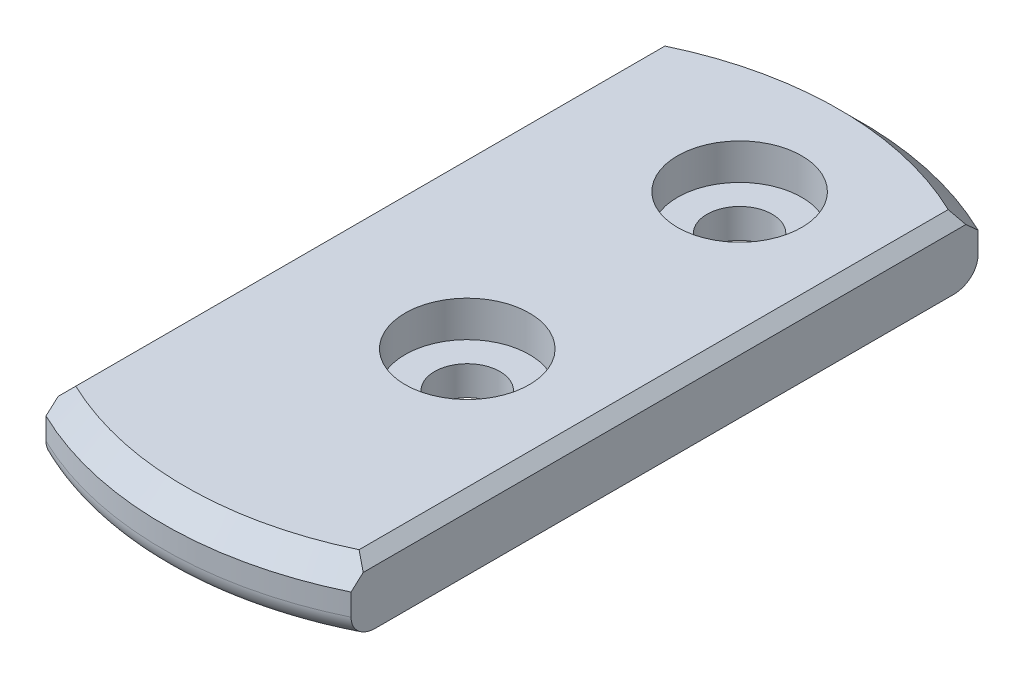
from build123d import *

# Parameters (mm, degrees)
SKETCH2_R           = 16
BOSS_EXTRUDE1_DEPTH = 3
SKETCH1_W           = 9
SKETCH1_H           = 32
CUT_EXTRUDE1_DEPTH  = 23.825424421
SKETCH3_R           = 1.5
CUT_EXTRUDE2_DEPTH  = 18.720045147
SKETCH4_R           = 2.85
CUT_EXTRUDE3_DEPTH  = 1.65
CHAMFER1_SIZE       = 0.5
FILLET1_R           = 1
CHAMFER2_SIZE       = 1


with BuildPart() as part:
    # Sketch2 → Boss-Extrude1 (new body)
    with BuildSketch(Plane(origin=(0, 0, 0), x_dir=(1, 0, 0), z_dir=(0, 1, 0))):
        Circle(SKETCH2_R)
    extrude(amount=BOSS_EXTRUDE1_DEPTH)

    # Sketch1 → Cut-Extrude1 (cut, through all)
    with BuildSketch(Plane(origin=(0, 0, 0), x_dir=(1, 0, 0), z_dir=(0, 1, 0))):
        with Locations((-11.5, 0)):
            Rectangle(SKETCH1_W, SKETCH1_H)
        with Locations((11.5, 0)):
            Rectangle(SKETCH1_W, SKETCH1_H)
    extrude(amount=CUT_EXTRUDE1_DEPTH, mode=Mode.SUBTRACT)

    # Sketch3 → Cut-Extrude2 (cut, through all)
    with BuildSketch(Plane(origin=(0, 3, 0), x_dir=(1, 0, 0), z_dir=(0, 1, 0))):
        with Locations((1, 9.4472)):
            Circle(SKETCH3_R)
        with Locations((1, -3.0528)):
            Circle(SKETCH3_R)
    extrude(amount=-CUT_EXTRUDE2_DEPTH, mode=Mode.SUBTRACT)

    # Sketch4 → Cut-Extrude3 (cut)
    with BuildSketch(Plane(origin=(0, 3, 0), x_dir=(1, 0, 0), z_dir=(0, 1, 0))):
        with Locations((1, 9.4472)):
            Circle(SKETCH4_R)
        with Locations((1, -3.0528)):
            Circle(SKETCH4_R)
    extrude(amount=-CUT_EXTRUDE3_DEPTH, mode=Mode.SUBTRACT)

    # Chamfer1
    chamfer1_edges = [part.edges().sort_by_distance(p)[0] for p in [
        (-7, 3, 0),
        (7, 3, 0),
    ]]
    chamfer(chamfer1_edges, length=CHAMFER1_SIZE)

    # Fillet1
    fillet1_edges = [part.edges().sort_by_distance(p)[0] for p in [
        (0, 0, -16),
        (0, 0, 16),
    ]]
    fillet(fillet1_edges, radius=FILLET1_R)

    # Chamfer2
    chamfer2_edges = [part.edges().sort_by_distance(p)[0] for p in [
        (0, 3, 16),
        (0, 3, -16),
    ]]
    chamfer(chamfer2_edges, length=CHAMFER2_SIZE)


solid = part.part
